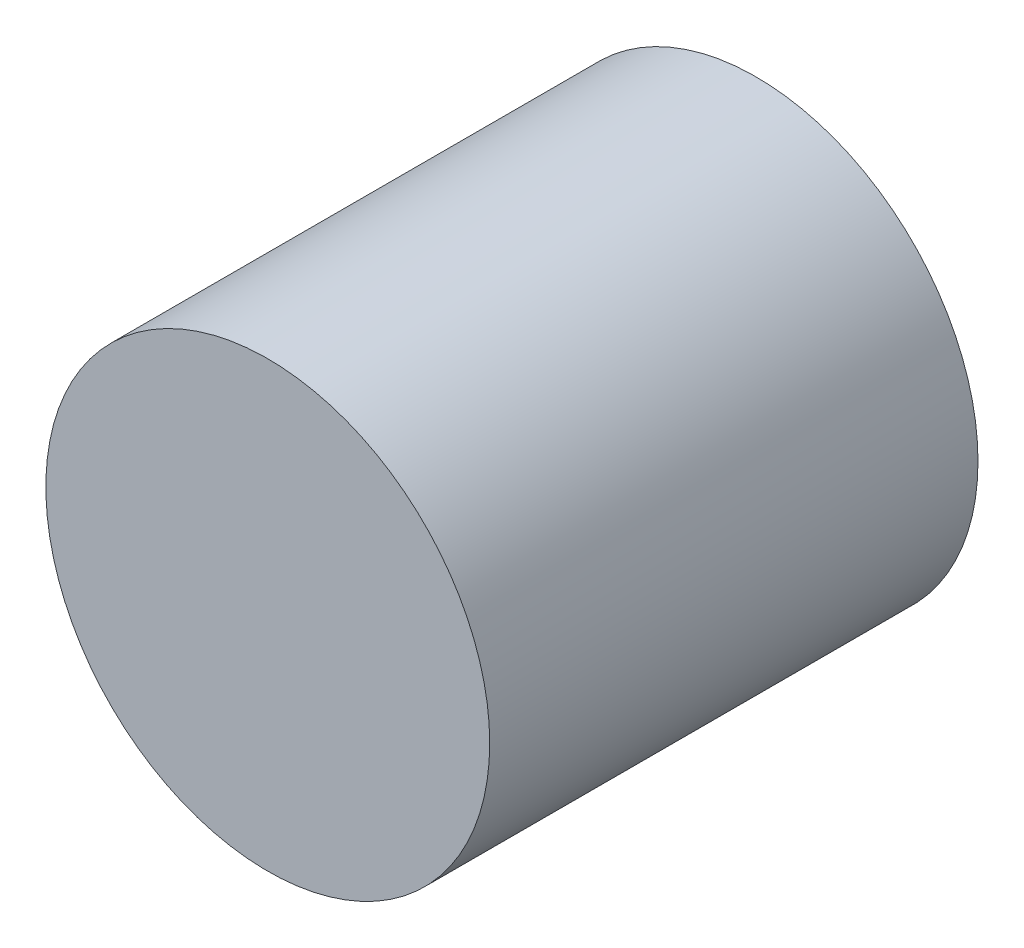
from build123d import *

# Parameters (mm, degrees)
SKETCH1_W             = 128.922622712
SKETCH1_H             = 108.547542538
SKETCH1_W_2           = 124.922622712
SKETCH1_H_2           = 104.547542538
BOSS_EXTRUDE1_DEPTH   = 50
SKETCH2_R             = 50
BOSS_EXTRUDE2_DEPTH   = 110
SKETCH3_R             = 6.994110628
BOSS_EXTRUDE3_DEPTH   = 20
SKETCH3_R_2           = 6.120691225
BOSS_EXTRUDE3_2_DEPTH = 20


with BuildPart() as part:
    # Sketch1 → Boss-Extrude1 (new body)
    with BuildSketch(Plane.XY):
        Rectangle(SKETCH1_W, SKETCH1_H)
        Rectangle(SKETCH1_W_2, SKETCH1_H_2, mode=Mode.SUBTRACT)
    extrude(amount=BOSS_EXTRUDE1_DEPTH)


with BuildPart() as body_2:
    # Sketch2 → Boss-Extrude2 (new body)
    with BuildSketch(Plane.XY):
        Circle(SKETCH2_R)
    extrude(amount=BOSS_EXTRUDE2_DEPTH)


with BuildPart() as body_3:
    # Sketch3 → Boss-Extrude3 (new body)
    with BuildSketch(Plane.XY):
        with Locations((-51.126362865, 41.516845757)):
            Circle(SKETCH3_R)
    extrude(amount=BOSS_EXTRUDE3_DEPTH)


with BuildPart() as body_4:
    # Sketch3 → Boss-Extrude3 2 (new body)
    with BuildSketch(Plane.XY):
        with Locations((46.461548735, 43.755956539)):
            Circle(SKETCH3_R_2)
    extrude(amount=BOSS_EXTRUDE3_2_DEPTH)


solid = body_2.part
